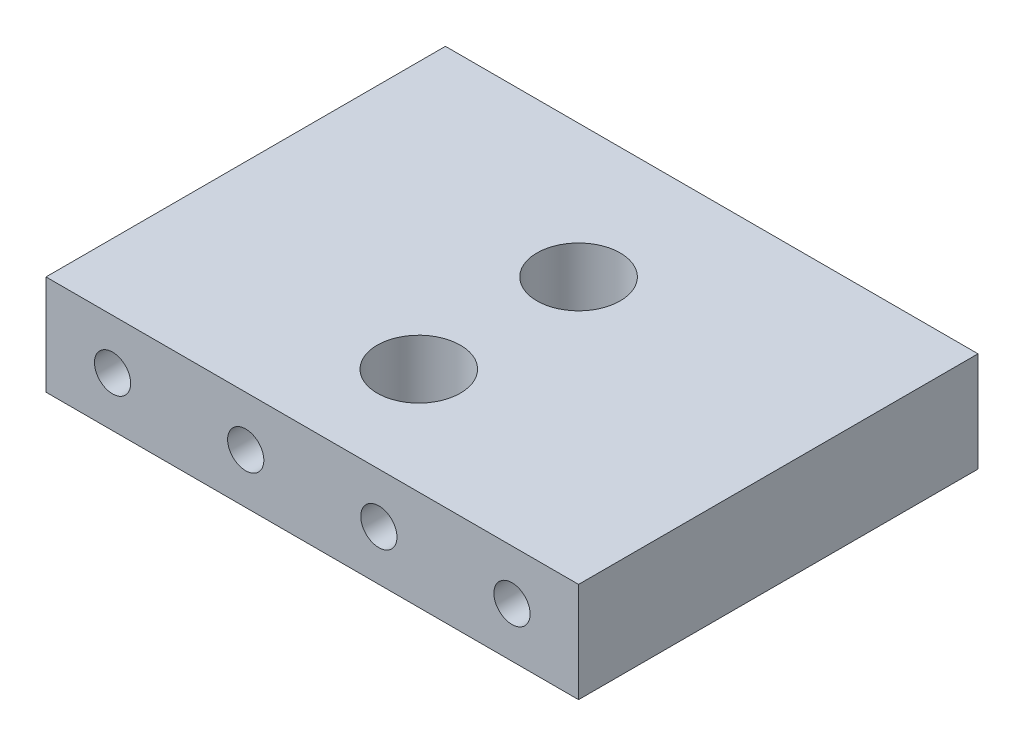
from build123d import *

# Parameters (mm, degrees)
SKETCH1_W                      = 50.8
SKETCH1_H                      = 9.525
BOSS_EXTRUDE1_DEPTH            = 38.1
F_5_16_0_3125_DIAMETER_HOLE1_D = 7.9375
F_8_36_TAPPED_HOLE1_D          = 3.4544


with BuildPart() as part:
    # Sketch1 → Boss-Extrude1 (new body)
    with BuildSketch(Plane.XY):
        Rectangle(SKETCH1_W, SKETCH1_H)
    extrude(amount=BOSS_EXTRUDE1_DEPTH)

    # 5/16 (0.3125) Diameter Hole1 (through all)
    with Locations(Plane(origin=(0, -4.7625, 0), x_dir=(-1, 0, 0), z_dir=(0, -1, 0))):
        with Locations((0, -12.7), (0, -27.94)):
            Hole(F_5_16_0_3125_DIAMETER_HOLE1_D / 2)

    # #8-36 Tapped Hole1 (through all)
    with Locations(Plane(origin=(0, 0, 0), x_dir=(-1, 0, 0), z_dir=(0, 0, -1))):
        with Locations((-19.05, 0), (-6.35, 0), (6.35, 0), (19.05, 0)):
            Hole(F_8_36_TAPPED_HOLE1_D / 2)


solid = part.part
